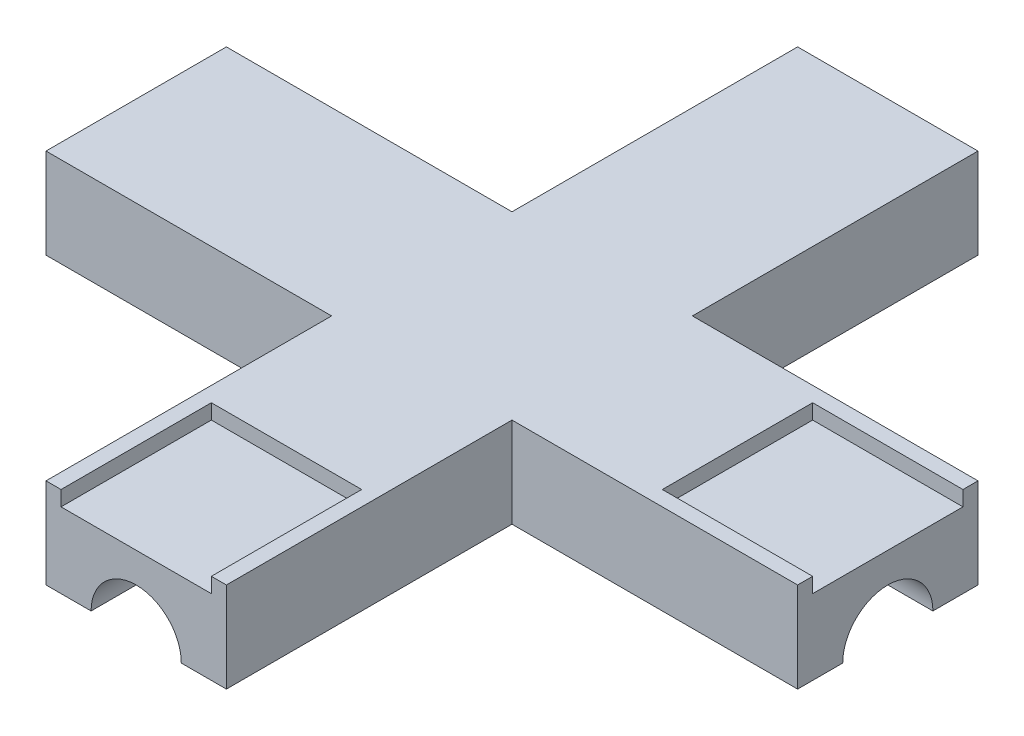
from build123d import *

# Parameters (mm, degrees)
SKETCH1_W           = 50
SKETCH1_H           = 50
BOSS_EXTRUDE1_DEPTH = 10
CUT_EXTRUDE1_REACH  = 58.789
SKETCH2_R           = 3
CIRPATTERN1_COUNT   = 4
SKETCH3_W           = 10
SKETCH3_H           = 10
CUT_EXTRUDE2_DEPTH  = 1
CUT_EXTRUDE3_REACH  = 38.742
SKETCH5_W           = 19
SKETCH5_H           = 19
SKETCH7_W           = 60
SKETCH7_H           = 60
CUT_EXTRUDE4_DEPTH  = 4


with BuildPart() as part:
    # Sketch1 → Boss-Extrude1 (new body)
    with BuildSketch(Plane(origin=(0, 0, 0), x_dir=(1, 0, 0), z_dir=(0, 1, 0))):
        Rectangle(SKETCH1_W, SKETCH1_H)
    extrude(amount=BOSS_EXTRUDE1_DEPTH)

    # Sketch2 → Cut-Extrude1 (cut, up to next)
    with BuildSketch(Plane(origin=(25, 0, 0), x_dir=(0, 0, -1), z_dir=(1, 0, 0)), mode=Mode.PRIVATE) as cut_extrude1_sk1:
        with Locations((0, 4)):
            Circle(SKETCH2_R)
    cut_extrude1_tool1 = extrude(cut_extrude1_sk1.sketch, amount=-CUT_EXTRUDE1_REACH, mode=Mode.PRIVATE) & part.part
    cut_extrude1 = cut_extrude1_tool1.solids().sort_by_distance((25, 4, 0))[0]
    add(cut_extrude1, mode=Mode.SUBTRACT)

    # CirPattern1: Cut-Extrude1 ×4 about axis
    cirpattern1_axis = Axis((0, 21, 0), (0, -1, 0))
    for i in range(1, CIRPATTERN1_COUNT):
        add(cut_extrude1.rotate(cirpattern1_axis, i * 360 / CIRPATTERN1_COUNT), mode=Mode.SUBTRACT)

    # Sketch3 → Cut-Extrude2 (cut)
    with BuildSketch(Plane(origin=(0, 10, 0), x_dir=(1, 0, 0), z_dir=(0, 1, 0))):
        with Locations((20, 0)):
            Rectangle(SKETCH3_W, SKETCH3_H)
        with Locations((0, -20)):
            Rectangle(SKETCH3_W, SKETCH3_H)
    extrude(amount=-CUT_EXTRUDE2_DEPTH, mode=Mode.SUBTRACT)

    # Sketch5 → Cut-Extrude3 (cut, up to next)
    with BuildSketch(Plane(origin=(0, 10, 0), x_dir=(1, 0, 0), z_dir=(0, 1, 0)), mode=Mode.PRIVATE) as cut_extrude3_sk1:
        with Locations((-15.5, 15.5)):
            Rectangle(SKETCH5_W, SKETCH5_H)
    cut_extrude3_tool1 = extrude(cut_extrude3_sk1.sketch, amount=-CUT_EXTRUDE3_REACH, mode=Mode.PRIVATE) & part.part
    # Sketch5 → Cut-Extrude3 (cut, up to next)
    with BuildSketch(Plane(origin=(0, 10, 0), x_dir=(1, 0, 0), z_dir=(0, 1, 0)), mode=Mode.PRIVATE) as cut_extrude3_sk2:
        with Locations((15.5, 15.5)):
            Rectangle(SKETCH5_W, SKETCH5_H)
    cut_extrude3_tool2 = extrude(cut_extrude3_sk2.sketch, amount=-CUT_EXTRUDE3_REACH, mode=Mode.PRIVATE) & part.part
    # Sketch5 → Cut-Extrude3 (cut, up to next)
    with BuildSketch(Plane(origin=(0, 10, 0), x_dir=(1, 0, 0), z_dir=(0, 1, 0)), mode=Mode.PRIVATE) as cut_extrude3_sk3:
        with Locations((-15.5, -15.5)):
            Rectangle(SKETCH5_W, SKETCH5_H)
    cut_extrude3_tool3 = extrude(cut_extrude3_sk3.sketch, amount=-CUT_EXTRUDE3_REACH, mode=Mode.PRIVATE) & part.part
    # Sketch5 → Cut-Extrude3 (cut, up to next)
    with BuildSketch(Plane(origin=(0, 10, 0), x_dir=(1, 0, 0), z_dir=(0, 1, 0)), mode=Mode.PRIVATE) as cut_extrude3_sk4:
        with Locations((15.5, -15.5)):
            Rectangle(SKETCH5_W, SKETCH5_H)
    cut_extrude3_tool4 = extrude(cut_extrude3_sk4.sketch, amount=-CUT_EXTRUDE3_REACH, mode=Mode.PRIVATE) & part.part
    add(cut_extrude3_tool1.solids().sort_by_distance((-15.5, 10, -15.5))[0], mode=Mode.SUBTRACT)
    add(cut_extrude3_tool2.solids().sort_by_distance((15.5, 10, -15.5))[0], mode=Mode.SUBTRACT)
    add(cut_extrude3_tool3.solids().sort_by_distance((-15.5, 10, 15.5))[0], mode=Mode.SUBTRACT)
    add(cut_extrude3_tool4.solids().sort_by_distance((15.5, 10, 15.5))[0], mode=Mode.SUBTRACT)

    # Sketch7 → Cut-Extrude4 (cut)
    with BuildSketch(Plane.XZ):
        Rectangle(SKETCH7_W, SKETCH7_H)
    extrude(amount=-CUT_EXTRUDE4_DEPTH, mode=Mode.SUBTRACT)


solid = part.part
